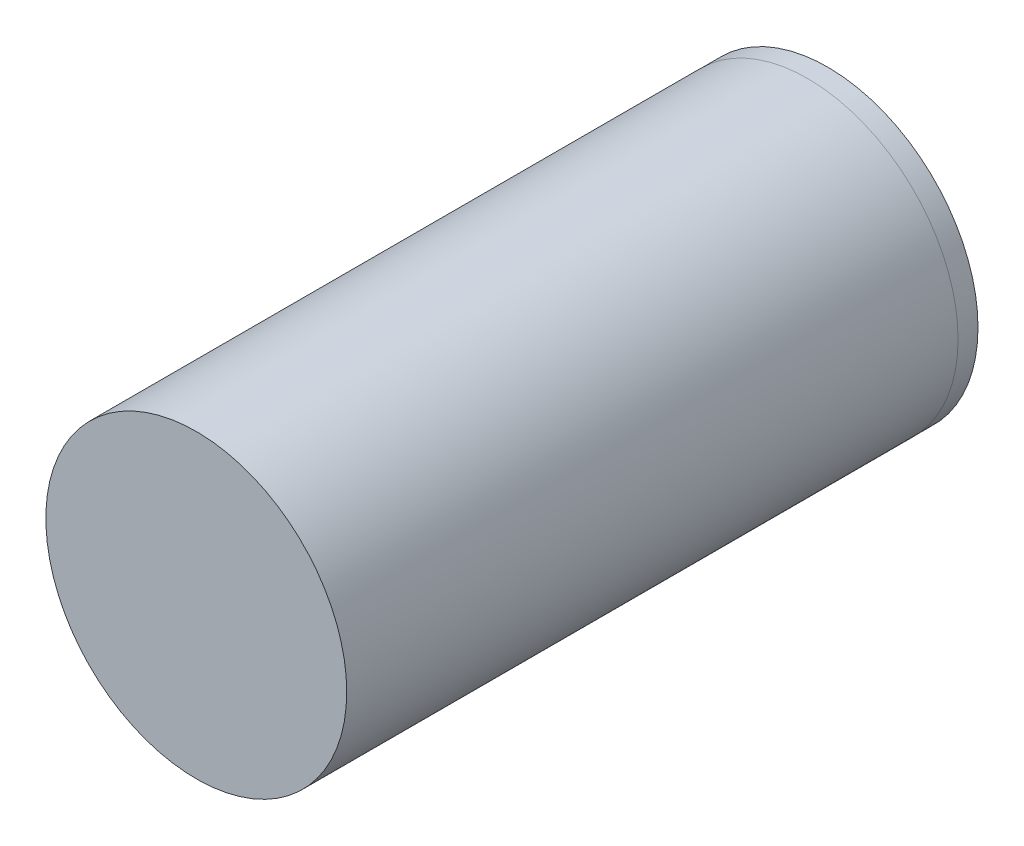
from build123d import *

# Parameters (mm, degrees)
SKETCH1_R           = 5.5
BOSS_EXTRUDE1_DEPTH = 3.25
SKETCH3_R           = 15
BOSS_EXTRUDE2_DEPTH = 2
SKETCH4_R           = 15.011076053
SKETCH4_R_2         = 13.011076053
BOSS_EXTRUDE3_DEPTH = 59
SKETCH5_R           = 15.011076053
BOSS_EXTRUDE4_DEPTH = 2


with BuildPart() as part:
    # Sketch1 → Boss-Extrude1 (new body)
    with BuildSketch(Plane.XY):
        with Locations((0.700759494, -0.350379747)):
            Circle(SKETCH1_R)
    extrude(amount=BOSS_EXTRUDE1_DEPTH)

    # Sketch3 → Boss-Extrude2 (add)
    with BuildSketch(Plane.XY.offset(3.25)):
        with Locations((0.700759494, -0.350379747)):
            Circle(SKETCH3_R)
    extrude(amount=BOSS_EXTRUDE2_DEPTH)

    # Sketch4 → Boss-Extrude3 (add)
    with BuildSketch(Plane.XY.offset(5.25)):
        with Locations((0.700759494, -0.350379747)):
            Circle(SKETCH4_R)
        with Locations((0.700759494, -0.350379747)):
            Circle(SKETCH4_R_2, mode=Mode.SUBTRACT)
    extrude(amount=BOSS_EXTRUDE3_DEPTH)

    # Sketch5 → Boss-Extrude4 (add)
    with BuildSketch(Plane.XY.offset(64.25)):
        with Locations((0.700759494, -0.350379747)):
            Circle(SKETCH5_R)
    extrude(amount=BOSS_EXTRUDE4_DEPTH)


solid = part.part
